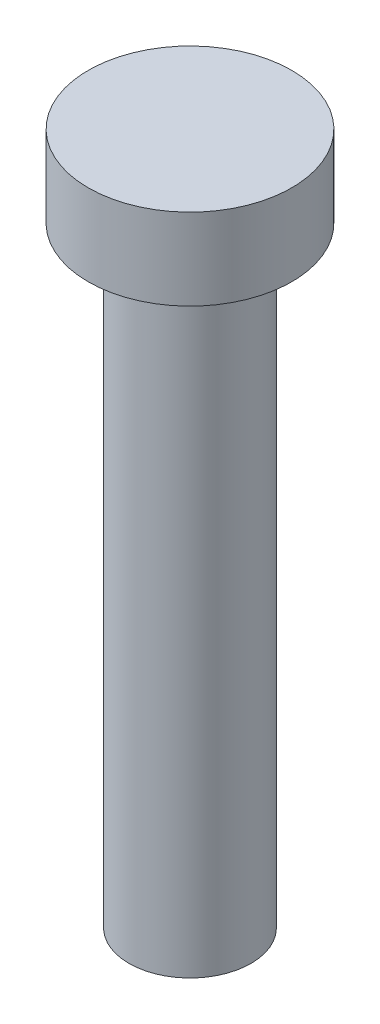
from build123d import *

# Parameters (mm, degrees)
ESQUISSE1_R      = 1.5
EXTRUSION1_DEPTH = 15
ESQUISSE2_R      = 2.5
EXTRUSION2_DEPTH = 2


with BuildPart() as part:
    # Esquisse1 → Extrusion1 (new body)
    with BuildSketch(Plane(origin=(0, 0, 0), x_dir=(1, 0, 0), z_dir=(0, 1, 0))):
        Circle(ESQUISSE1_R)
    extrude(amount=EXTRUSION1_DEPTH)

    # Esquisse2 → Extrusion2 (add)
    with BuildSketch(Plane(origin=(0, 15, 0), x_dir=(1, 0, 0), z_dir=(0, 1, 0))):
        Circle(ESQUISSE2_R)
    extrude(amount=EXTRUSION2_DEPTH)


solid = part.part
